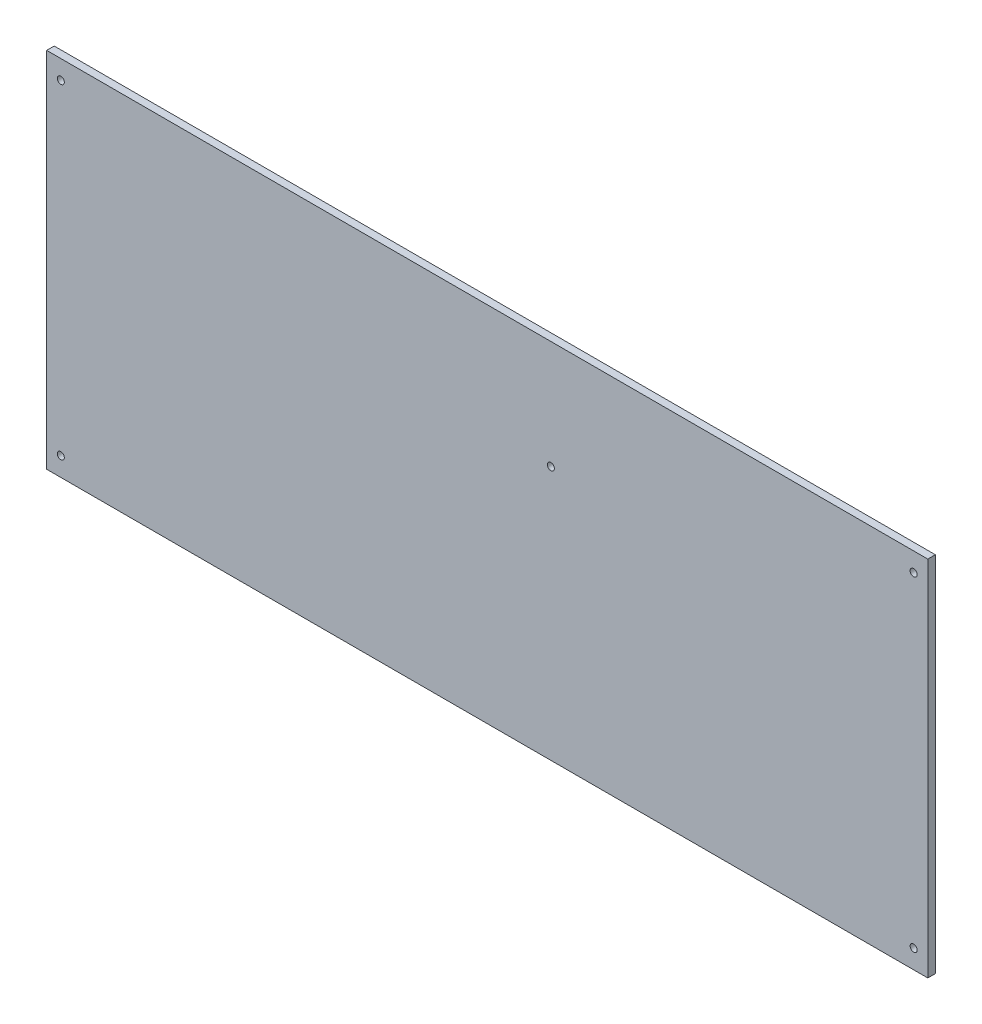
from build123d import *

# Parameters (mm, degrees)
KEEPOUTLAYER_W          = 186.99999938
KEEPOUTLAYER_H          = 77.00000094
EXTRUDE_1_DEPTH         = 1.6
CUT_EXTRUDE_START       = -1.6
CUT_EXTRUDE_1_OUTLINE_R = 0.7499985
CUT_EXTRUDE_1_DEPTH     = 1.6


# Read off the part's stored shape, not the designer's step: Вырез-Вытянуть1
with BuildPart() as part:
    # KeepOutLayer → Бобышка-Вытянуть1 (new body)
    with BuildSketch(Plane.XY):
        with Locations((93.49999969, -38.50000047)):
            Rectangle(KEEPOUTLAYER_W, KEEPOUTLAYER_H)
    extrude(amount=-EXTRUDE_1_DEPTH)

    # Вырез-Вытянуть1 outline → Вырез-Вытянуть1 (cut)
    with BuildSketch(Plane.XY.offset(CUT_EXTRUDE_START)):
        with Locations((184.0000003, -3.99999962)):
            Circle(CUT_EXTRUDE_1_OUTLINE_R)
        with Locations((106.99999936, -22.99999972)):
            Circle(CUT_EXTRUDE_1_OUTLINE_R)
        with Locations((3.00000162, -73.00000132)):
            Circle(CUT_EXTRUDE_1_OUTLINE_R)
        with Locations((3.00000162, -3.99999962)):
            Circle(CUT_EXTRUDE_1_OUTLINE_R)
        with Locations((184.0000003, -73.00000132)):
            Circle(CUT_EXTRUDE_1_OUTLINE_R)
    extrude(amount=CUT_EXTRUDE_1_DEPTH, mode=Mode.SUBTRACT)


solid = part.part
